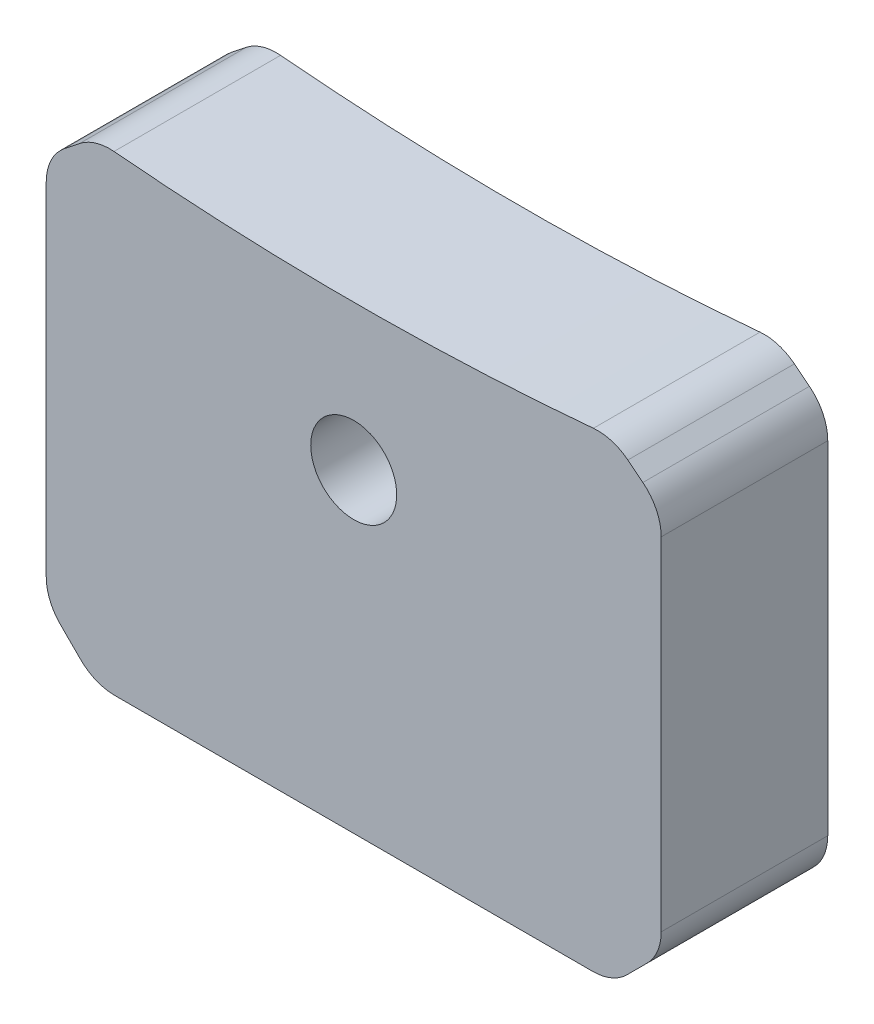
from build123d import *

# Parameters (mm, degrees)
SKETCH1_W           = 25.4
SKETCH1_H           = 32.3
BOSS_EXTRUDE1_DEPTH = 6.88
SKETCH3_R           = 111
SKETCH3_R_2         = 1.775
CUT_EXTRUDE1_DEPTH  = 6.88
CHAMFER1_SIZE       = 1.805302587
CHAMFER1_SIZE_2     = 2
FILLET1_R           = 2


with BuildPart() as part:
    # Sketch1 → Boss-Extrude1 (new body)
    with BuildSketch(Plane.XY):
        Rectangle(SKETCH1_W, SKETCH1_H)
    extrude(amount=BOSS_EXTRUDE1_DEPTH)

    # Sketch3 → Cut-Extrude1 (cut)
    with BuildSketch(Plane(origin=(0, 0, 0), x_dir=(-1, 0, 0), z_dir=(0, 0, -1))):
        with Locations((0, 113.850000001)):
            Circle(SKETCH3_R)
        with Locations((0, -3.149999999)):
            Circle(SKETCH3_R_2)
    extrude(amount=-CUT_EXTRUDE1_DEPTH, mode=Mode.SUBTRACT)

    # Chamfer1
    # the kernel refuses this chamfer: 2, 1.805302587 mm, written as the material it takes off along each edge
    with BuildSketch(Plane(origin=(-12.7, 3.578924918, 12.070681021), x_dir=(0, -1, 0), z_dir=(0, 0, -1))) as chamfer1_piece_1:
        with BuildLine():
            Line((CHAMFER1_SIZE, 0), (0.212697329, -2.007197118))
            ThreePointArc((0.212697329, -2.007197118), (0.113915873, -1.031505174), (0, 0))
            Line((0, 0), (CHAMFER1_SIZE, 0))
        make_face()
    extrude(amount=17.261362042, mode=Mode.SUBTRACT)
    with BuildSketch(Plane(origin=(12.7, 3.578924918, 12.070681021), x_dir=(0, -1, 0), z_dir=(0, 0, -1))) as chamfer1_piece_2:
        with BuildLine():
            Line((CHAMFER1_SIZE, 0), (0.212697329, 2.007197118))
            ThreePointArc((0.212697329, 2.007197118), (0.113915873, 1.031505174), (0, 0))
            Line((0, 0), (CHAMFER1_SIZE, 0))
        make_face()
    extrude(amount=17.261362042, mode=Mode.SUBTRACT)
    with BuildSketch(Plane(origin=(12.7, -16.15, -5.143365976), x_dir=(-1, 0, 0), z_dir=(0, 0, 1))) as chamfer1_piece_3:
        Polygon((CHAMFER1_SIZE_2, 0), (0, -CHAMFER1_SIZE_2), (0, 0), align=None)
    extrude(amount=17.166731952, mode=Mode.SUBTRACT)
    with BuildSketch(Plane(origin=(-12.7, -16.15, -5.143365976), x_dir=(1, 0, 0), z_dir=(0, 0, 1))) as chamfer1_piece_4:
        Polygon((CHAMFER1_SIZE_2, 0), (0, CHAMFER1_SIZE_2), (0, 0), align=None)
    extrude(amount=17.166731952, mode=Mode.SUBTRACT)

    # Fillet1
    fillet1_edges = [part.edges().sort_by_distance(p)[0] for p in [
        (12.7, -14.15, 3.44),
        (12.7, 1.773622331, 3.44),
        (-10.692802882, 3.366227588, 3.44),
        (10.692802882, 3.366227588, 3.44),
        (-10.7, -16.15, 3.44),
        (10.7, -16.15, 3.44),
        (-12.7, -14.15, 3.44),
        (-12.7, 1.773622331, 3.44),
    ]]
    fillet(fillet1_edges, radius=FILLET1_R)


solid = part.part
